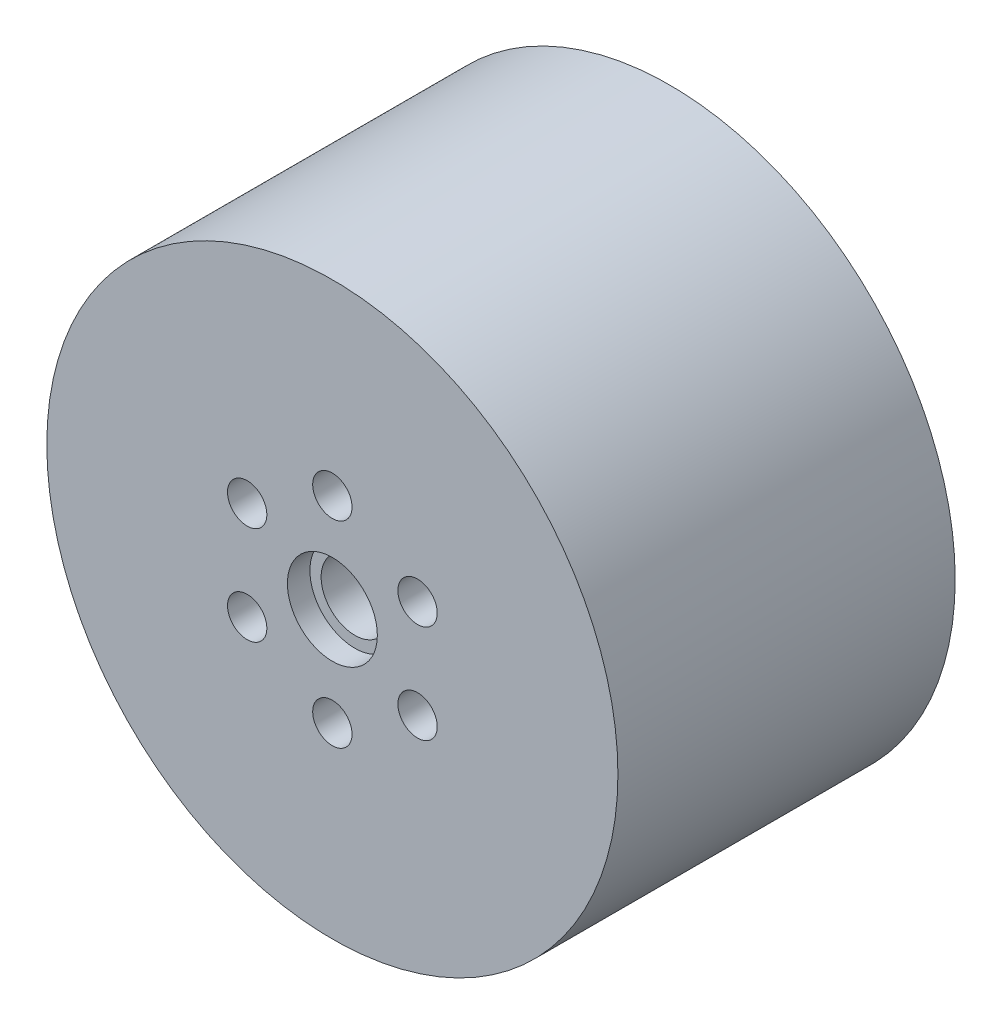
from build123d import *

# Parameters (mm, degrees)
SKETCH1_R           = 25.4
BOSS_EXTRUDE1_DEPTH = 30
SKETCH2_R           = 3
CUT_EXTRUDE1_DEPTH  = 47.800854693
SKETCH3_R           = 4
CUT_EXTRUDE3_DEPTH  = 2
CUT_EXTRUDE4_START  = -2
SKETCH4_R           = 4
CUT_EXTRUDE4_DEPTH  = 2
SKETCH5_R           = 1.75
CUT_EXTRUDE5_DEPTH  = 5
CIRPATTERN1_COUNT   = 6


with BuildPart() as part:
    # Sketch1 → Boss-Extrude1 (new body)
    with BuildSketch(Plane.XY):
        Circle(SKETCH1_R)
    extrude(amount=BOSS_EXTRUDE1_DEPTH)

    # Sketch2 → Cut-Extrude1 (cut, through all)
    with BuildSketch(Plane.XY.offset(30)):
        Circle(SKETCH2_R)
    extrude(amount=-CUT_EXTRUDE1_DEPTH, mode=Mode.SUBTRACT)

    # Sketch3 → Cut-Extrude3 (cut)
    with BuildSketch(Plane.XY.offset(30)):
        Circle(SKETCH3_R)
    extrude(amount=-CUT_EXTRUDE3_DEPTH, mode=Mode.SUBTRACT)

    # Sketch4 → Cut-Extrude4 (cut)
    with BuildSketch(Plane(origin=(0, 0, 0), x_dir=(-1, 0, 0), z_dir=(0, 0, -1)).offset(CUT_EXTRUDE4_START)):
        Circle(SKETCH4_R)
    extrude(amount=CUT_EXTRUDE4_DEPTH, mode=Mode.SUBTRACT)

    # Sketch5 → Cut-Extrude5 (cut)
    with BuildSketch(Plane.XY.offset(30)):
        with Locations((0, 8.75)):
            Circle(SKETCH5_R)
    cut_extrude5 = extrude(amount=-CUT_EXTRUDE5_DEPTH, mode=Mode.SUBTRACT)

    # CirPattern1: Cut-Extrude5 ×6 about axis
    cirpattern1_axis = Axis((0, 0, 30), (0, 0, 1))
    for i in range(1, CIRPATTERN1_COUNT):
        add(cut_extrude5.rotate(cirpattern1_axis, i * 360 / CIRPATTERN1_COUNT), mode=Mode.SUBTRACT)


solid = part.part
